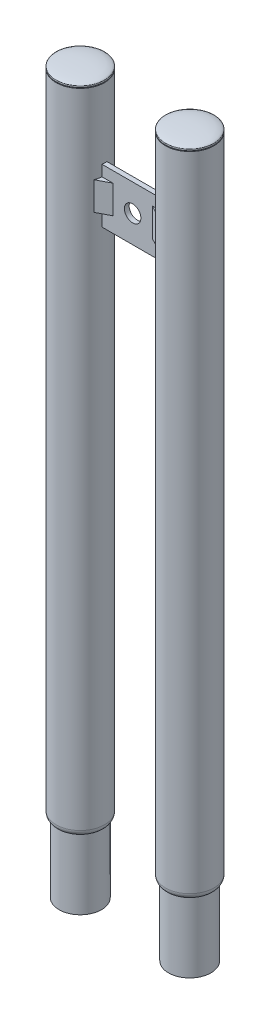
from build123d import *
from build123d.topology import SkipClean

# Parameters (mm, degrees)
SKETCH1_W                = 28
SKETCH1_H                = 25
SKETCH1_R                = 3.8
BOSS_EXTRUDE1_DEPTH      = 1.1
BOSS_EXTRUDE2_DEPTH      = 241
BOSS_EXTRUDE2_DEPTH_BACK = 57
SKETCH2_R                = 11.15
SKETCH2_R_2              = 10.05
SKETCH3_R                = 11.15
SKETCH3_R_2              = 8.65
BOSS_EXTRUDE3_DEPTH      = 1.1
SKETCH4_R                = 9.75
SKETCH4_R_2              = 8.65
BOSS_EXTRUDE4_DEPTH      = 32
FILLET1_R                = 3
CUT_EXTRUDE1_REACH       = 290.014
CUT_EXTRUDE1_END_RADIUS  = 9.75
SKETCH8_R                = 2
CHAMFER1_SIZE            = 0.3
BOSS_EXTRUDE5_DEPTH      = 25
BOSS_EXTRUDE5_2_DEPTH    = 25
BOSS_EXTRUDE6_START      = -5
BOSS_EXTRUDE6_DEPTH      = 13


with BuildPart() as part:
    # Sketch1 → Boss-Extrude1 (new, symmetric)
    with BuildSketch(Plane.XY):
        Rectangle(SKETCH1_W, SKETCH1_H)
        Circle(SKETCH1_R, mode=Mode.SUBTRACT)
    extrude(amount=BOSS_EXTRUDE1_DEPTH, both=True)


with BuildPart() as body_2:
    # Sketch2 → Boss-Extrude2 (new, two sides: drawn at the far end of the back side and taken through both)
    with BuildSketch(Plane.XZ.offset(12.5).offset(-BOSS_EXTRUDE2_DEPTH_BACK)):
        with Locations(Location((-25.15, 0, 0), (0, 0, 270))):
            Circle(SKETCH2_R)
        with Locations(Location((-25.15, 0, 0), (0, 0, 270))):
            Circle(SKETCH2_R_2, mode=Mode.SUBTRACT)
    extrude(amount=BOSS_EXTRUDE2_DEPTH + BOSS_EXTRUDE2_DEPTH_BACK)

    # Sketch3 → Boss-Extrude3 (add)
    with BuildSketch(Plane.XZ.offset(253.5)):
        with Locations(Location((-25.15, 0, 0), (0, 0, 270))):
            Circle(SKETCH3_R)
        with Locations(Location((-25.15, 0, 0), (0, 0, 270))):
            Circle(SKETCH3_R_2, mode=Mode.SUBTRACT)
    extrude(amount=-BOSS_EXTRUDE3_DEPTH)

    # Sketch4 → Boss-Extrude4 (add)
    with SkipClean():  # the faces are left unmerged after this step: merging them gives an invalid solid
        with BuildSketch(Plane.XZ.offset(253.5)):
            with Locations(Location((-25.15, 0, 0), (0, 0, 270))):
                Circle(SKETCH4_R)
            with Locations(Location((-25.15, 0, 0), (0, 0, 270))):
                Circle(SKETCH4_R_2, mode=Mode.SUBTRACT)
        extrude(amount=BOSS_EXTRUDE4_DEPTH)

    # Fillet1
    # the kernel refuses this fillet: 3 mm, written as the material it adds along each edge
    with BuildSketch(Plane(origin=(-25.15, -252.4, 0), x_dir=(0, 0, -1), z_dir=(1, 0, 0))) as fillet1_piece_1:
        with BuildLine():
            CenterArc((7.05, 2.537715508), FILLET1_R, 302.230952635, 57.769047365)
            Line((8.65, 0), (8.682, -0.05075431))
            ThreePointArc((8.682, -0.05075431), (9.35, -0.06), (10.05, -0.06))
            Line((10.05, -0.06), (10.11, 0))
            Line((10.11, 0), (10.11, 2.537715508))
            Line((10.11, 2.537715508), (10.05, 2.537715508))
        make_face()
    revolve(axis=Axis((-25.15, -252.4, 0), (0, 1, 0)))
    # the kernel refuses this fillet: 3 mm, written as the material it takes off along each edge
    with BuildSketch(Plane(origin=(-25.15, -253.5, 0), x_dir=(0, 0, -1), z_dir=(-1, 0, 0))) as fillet1_2_piece_1:
        with BuildLine():
            CenterArc((8.15, -2.537715508), FILLET1_R, 0, 57.769047365)
            Line((9.75, 0), (9.782, 0.05075431))
            ThreePointArc((9.782, 0.05075431), (10.45, 0.06), (11.15, 0.06))
            Line((11.15, 0.06), (11.21, 0))
            Line((11.21, 0), (11.21, -2.537715508))
            Line((11.21, -2.537715508), (11.15, -2.537715508))
        make_face()
    revolve(axis=Axis((-25.15, -253.5, 0), (0, -1, 0)), mode=Mode.SUBTRACT)

    # Cut-Extrude1: up to this cylinder (the profile starts inside it)
    cut_extrude1_end = Plane(origin=(-25.15, -270.5, 0), z_dir=(0, 1, 0)) * Cylinder(CUT_EXTRUDE1_END_RADIUS, 600.528, mode=Mode.PRIVATE)
    # Sketch8 → Cut-Extrude1 (cut, up to the surface)
    with BuildSketch(Plane.XY, mode=Mode.PRIVATE) as cut_extrude1_sk1:
        with Locations((-25.15, -270.5)):
            Circle(SKETCH8_R)
    cut_extrude1_tool1 = extrude(cut_extrude1_sk1.sketch, amount=-CUT_EXTRUDE1_REACH, mode=Mode.PRIVATE) & cut_extrude1_end
    add(cut_extrude1_tool1.solids().sort_by_distance((-25.15, -270.5, 0))[0], mode=Mode.SUBTRACT)


with BuildPart() as body_3:
    # Sketch5 → Revolve1 (revolve)
    with SkipClean():  # the faces are left unmerged after this step: merging them gives an invalid solid
        with BuildSketch(Plane.XY, mode=Mode.PRIVATE) as revolve1_sk:
            with BuildLine():
                add(Edge.make_bspline(
                    [(-14, 45.5), (-14, 47), (-25.15, 47)],
                    knots=[3.141592654, 3.141592654, 3.141592654, 4.71238898, 4.71238898, 4.71238898], degree=2, weights=[1, 0.707106781, 1]))
                Line((-25.15, 47), (-25.15, 45.5))
                Line((-25.15, 45.5), (-14, 45.5))
            make_face()
            with BuildLine():
                Line((-25.15, 45.5), (-25.15, 47))
                add(Edge.make_bspline(
                    [(-25.15, 47), (-36.3, 47), (-36.3, 45.5)],
                    knots=[4.71238898, 4.71238898, 4.71238898, 6.283185307, 6.283185307, 6.283185307], degree=2, weights=[1, 0.707106781, 1]))
                Line((-36.3, 45.5), (-25.15, 45.5))
            make_face()
            with BuildLine():
                Line((-14, 45.5), (-25.15, 45.5))
                Line((-25.15, 45.5), (-25.15, 44.5))
                Line((-25.15, 44.5), (-16.839280684, 44.5))
                add(Edge.make_bspline(
                    [(-16.839280684, 44.5), (-14, 44.927050983), (-14, 45.5)],
                    knots=[2.411864997, 2.411864997, 2.411864997, 3.141592654, 3.141592654, 3.141592654], degree=2, weights=[1, 0.934172359, 1]))
            make_face()
            with BuildLine():
                Line((-25.15, 44.5), (-25.15, 45.5))
                Line((-25.15, 45.5), (-36.3, 45.5))
                add(Edge.make_bspline(
                    [(-36.3, 45.5), (-36.3, 44.927050983), (-33.460719316, 44.5)],
                    knots=[0, 0, 0, 0.729727656, 0.729727656, 0.729727656], degree=2, weights=[1, 0.934172359, 1]))
                Line((-33.460719316, 44.5), (-25.15, 44.5))
            make_face()
            with BuildLine():
                add(Edge.make_bspline(
                    [(-36.3, 45.5), (-36.3, 44.927050983), (-33.460719316, 44.5)],
                    knots=[0, 0, 0, 0.729727656, 0.729727656, 0.729727656], degree=2, weights=[1, 0.934172359, 1]))
                Line((-36.3, 45.5), (-36.3, 44.5))
                Line((-36.3, 44.5), (-33.460719316, 44.5))
            make_face()
        revolve(revolve1_sk.sketch.rotate(Axis((-25.15, 47, 0), (0, -1, 0)), 270), axis=Axis((-25.15, 47, 0), (0, -1, 0)))
    add(body_3.part.scale(1), mode=Mode.REPLACE)  # the faces are merged on a copy

    # Chamfer1
    chamfer1_edges = [body_3.edges().sort_by_distance(p)[0] for p in [
        (-25.15, 44.5, -11.15),
    ]]
    chamfer(chamfer1_edges, length=CHAMFER1_SIZE)


with BuildPart() as body_4:
    # Sketch6 → Boss-Extrude5 (new body)
    with BuildSketch(Plane(origin=(0, 12.5, 0), x_dir=(1, 0, 0), z_dir=(0, 1, 0))):
        with BuildLine():
            Line((-14, 0), (-14, 1.1))
            Line((-14, 1.1), (-14.054392761, 1.1))
            ThreePointArc((-14.054392761, 1.1), (-14.013606492, 0.550671992), (-14, 0))
        make_face()
    extrude(amount=-BOSS_EXTRUDE5_DEPTH)


with BuildPart() as body_5:
    # Sketch6 → Boss-Extrude5 2 (new body)
    with BuildSketch(Plane(origin=(0, 12.5, 0), x_dir=(1, 0, 0), z_dir=(0, 1, 0))):
        with BuildLine():
            Line((-14, -1.1), (-14, 0))
            ThreePointArc((-14, 0), (-14.013606492, -0.550671992), (-14.054392761, -1.1))
            Line((-14.054392761, -1.1), (-14, -1.1))
        make_face()
    extrude(amount=-BOSS_EXTRUDE5_2_DEPTH)


with BuildPart() as body_6:
    # Sketch7 → Boss-Extrude6 (new body)
    with BuildSketch(Plane(origin=(0, 12.5, 0), x_dir=(1, 0, 0), z_dir=(0, 1, 0)).offset(BOSS_EXTRUDE6_START)):
        with BuildLine():
            Line((-14.781176537, -4.1), (-9.054392761, -1.1))
            Line((-9.054392761, -1.1), (-14, -1.1))
            Line((-14, -1.1), (-14.054392761, -1.1))
            ThreePointArc((-14.054392761, -1.1), (-14.313467052, -2.625272112), (-14.781176537, -4.1))
        make_face()
    extrude(amount=-BOSS_EXTRUDE6_DEPTH)


with BuildPart() as body_7:
    # Mirror1: mirrored copy
    add(body_2.part.mirror(Plane(origin=(0, 0, 0), x_dir=(0, 0, 1), z_dir=(1, 0, 0))))


with BuildPart() as body_8:
    # Mirror1 2: mirrored copy
    add(body_3.part.mirror(Plane(origin=(0, 0, 0), x_dir=(0, 0, 1), z_dir=(1, 0, 0))))


with BuildPart() as body_9:
    # Mirror1 3: mirrored copy
    add(body_4.part.mirror(Plane(origin=(0, 0, 0), x_dir=(0, 0, 1), z_dir=(1, 0, 0))))


with BuildPart() as body_10:
    # Mirror1 4: mirrored copy
    add(body_5.part.mirror(Plane(origin=(0, 0, 0), x_dir=(0, 0, 1), z_dir=(1, 0, 0))))


with BuildPart() as body_11:
    # Mirror1 5: mirrored copy
    add(body_6.part.mirror(Plane(origin=(0, 0, 0), x_dir=(0, 0, 1), z_dir=(1, 0, 0))))


with BuildPart() as part_1:
    add(part.part)

    # Combine1: union body 2, body 3, body 4, body 5, body 6, body 7, body 8, body 9, body 10, body 11
    add(body_2.part)
    add(body_3.part)
    add(body_4.part)
    add(body_5.part)
    add(body_6.part)
    add(body_7.part)
    add(body_8.part)
    add(body_9.part)
    add(body_10.part)
    add(body_11.part)


solid = part_1.part
